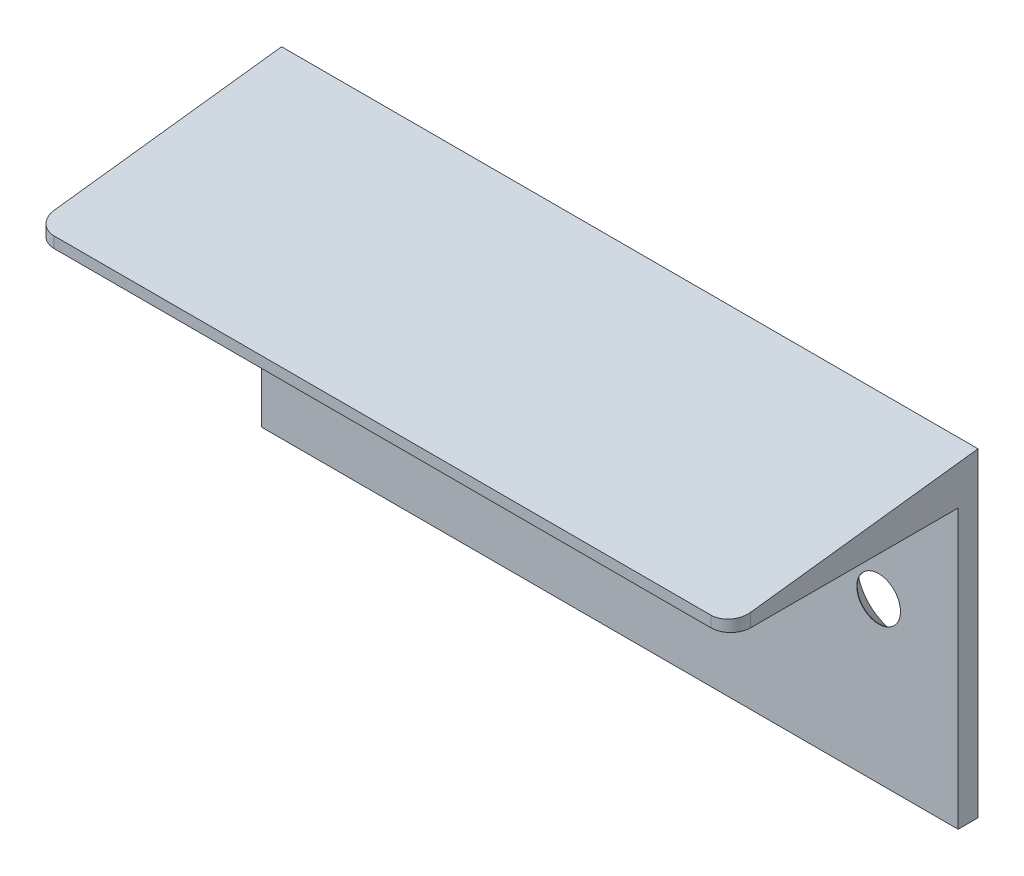
from build123d import *

# Parameters (mm, degrees)
SKETCH1_W                                       = 87.6
SKETCH1_H                                       = 40.2
BOSS_EXTRUDE1_DEPTH                             = 2.5
SKETCH3_W                                       = 87.6
SKETCH3_H                                       = 5.2
BOSS_EXTRUDE2_DEPTH                             = 28.599
FILLET1_R                                       = 2.5
SKETCH4_W                                       = 87.6
SKETCH4_H                                       = 37.342788029
CUT_REVOLVE2_ANGLE                              = 7
CSK_FOR_M5_FLAT_HEAD_MACHINE_SCREW1_D           = 5.5
CSK_FOR_M5_FLAT_HEAD_MACHINE_SCREW1_DEPTH       = 12.4
CSK_FOR_M5_FLAT_HEAD_MACHINE_SCREW1_CSINK_D     = 10.4
CSK_FOR_M5_FLAT_HEAD_MACHINE_SCREW1_CSINK_ANGLE = 90
CSK_FOR_M5_FLAT_HEAD_MACHINE_SCREW1_TIP         = 1.652366702


with BuildPart() as part:
    # Sketch1 → Boss-Extrude1 (new body)
    with BuildSketch(Plane.XY):
        Rectangle(SKETCH1_W, SKETCH1_H)
    extrude(amount=BOSS_EXTRUDE1_DEPTH)

    # Sketch3 → Boss-Extrude2 (add)
    with BuildSketch(Plane.XY.offset(2.5)):
        with Locations((0, 17.5)):
            Rectangle(SKETCH3_W, SKETCH3_H)
    extrude(amount=BOSS_EXTRUDE2_DEPTH)

    # Fillet1
    fillet1_edges = [part.edges().sort_by_distance(p)[0] for p in [
        (-43.8, 17.5, 31.099),
        (43.8, 17.5, 31.099),
    ]]
    fillet(fillet1_edges, radius=FILLET1_R)

    # Sketch4 → Cut-Revolve2 (revolve, cut)
    with BuildSketch(Plane(origin=(0, 20.1, 0), x_dir=(1, 0, 0), z_dir=(0, 1, 0))):
        with Locations((0, -18.671394015)):
            Rectangle(SKETCH4_W, SKETCH4_H)
    revolve(axis=Axis((-43.8, 20.1, 0), (1, 0, 0)), revolution_arc=CUT_REVOLVE2_ANGLE, mode=Mode.SUBTRACT)

    # CSK for M5 Flat Head Machine Screw1
    with Locations(Plane(origin=(0, 0, 0), x_dir=(-1, 0, 0), z_dir=(0, 0, -1))):
        with Locations((-33.8, 0), (33.8, 0)):
            CounterSinkHole(CSK_FOR_M5_FLAT_HEAD_MACHINE_SCREW1_D / 2, CSK_FOR_M5_FLAT_HEAD_MACHINE_SCREW1_CSINK_D / 2, depth=CSK_FOR_M5_FLAT_HEAD_MACHINE_SCREW1_DEPTH, counter_sink_angle=CSK_FOR_M5_FLAT_HEAD_MACHINE_SCREW1_CSINK_ANGLE)
            with Locations((0, 0, -(CSK_FOR_M5_FLAT_HEAD_MACHINE_SCREW1_DEPTH + CSK_FOR_M5_FLAT_HEAD_MACHINE_SCREW1_TIP / 2))):  # 118° drill point
                Cone(0, CSK_FOR_M5_FLAT_HEAD_MACHINE_SCREW1_D / 2, CSK_FOR_M5_FLAT_HEAD_MACHINE_SCREW1_TIP, mode=Mode.SUBTRACT)


solid = part.part
